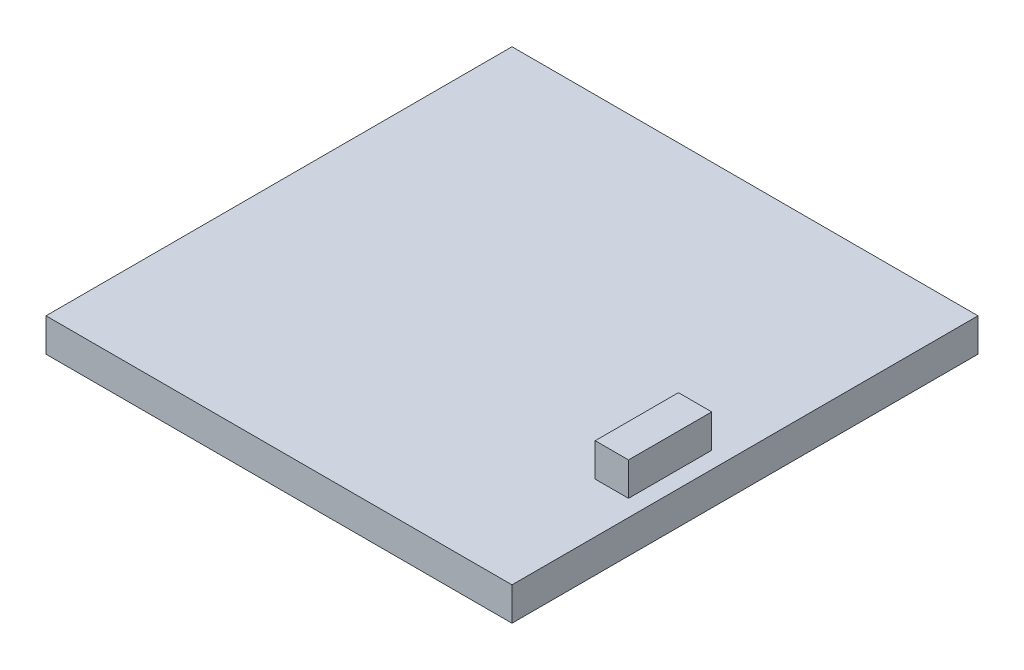
from build123d import *

# Parameters (mm, degrees)
SKETCH1_W           = 711.2
SKETCH1_H           = 711.2
BOSS_EXTRUDE1_DEPTH = 50.8
SKETCH2_W           = 50.8
SKETCH2_H           = 127
BOSS_EXTRUDE2_DEPTH = 50.8


with BuildPart() as part:
    # Sketch1 → Boss-Extrude1 (new body)
    with BuildSketch(Plane(origin=(0, 0, 0), x_dir=(1, 0, 0), z_dir=(0, 1, 0))):
        Rectangle(SKETCH1_W, SKETCH1_H)
    extrude(amount=BOSS_EXTRUDE1_DEPTH)

    # Sketch2 → Boss-Extrude2 (add)
    with BuildSketch(Plane(origin=(0, 50.8, 0), x_dir=(1, 0, 0), z_dir=(0, 1, 0))):
        with Locations((304.8, -88.9)):
            Rectangle(SKETCH2_W, SKETCH2_H)
    extrude(amount=BOSS_EXTRUDE2_DEPTH)


solid = part.part
